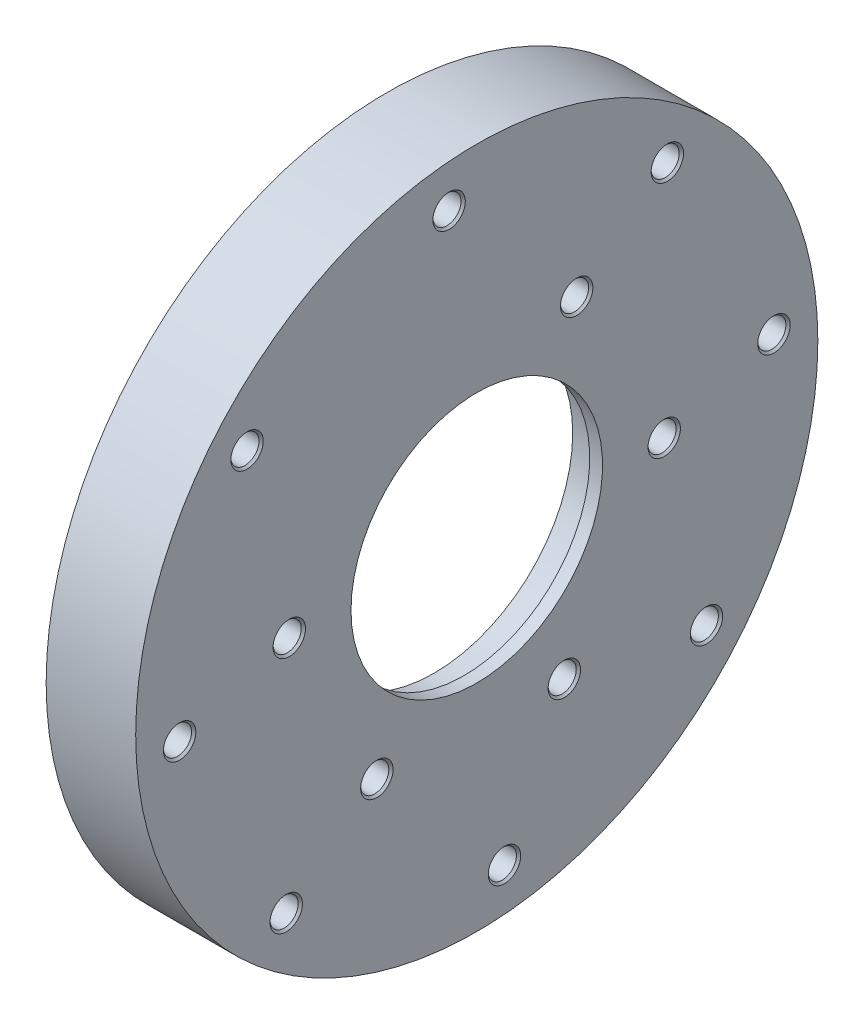
from build123d import *

# Parameters (mm, degrees)
SKETCH3_R          = 2.51
CUT_EXTRUDE1_DEPTH = 4
SKETCH6_R          = 3
CUT_EXTRUDE4_DEPTH = 11
SKETCH7_R          = 3.3
CUT_EXTRUDE5_DEPTH = 10
SKETCH9_R          = 1
CUT_EXTRUDE7_DEPTH = 2
CUT_EXTRUDE8_REACH = 117.07
SKETCH10_R         = 3.3
CHAMFER1_SIZE      = 0.5


with BuildPart() as part:
    # Sketch2 → Revolve1 (revolve)
    with BuildSketch(Plane.XY):
        Polygon((0, 80), (0, 52.5), (11, 52.5), (11, 32.5), (18, 32.5), (18, 29.5), (21, 29.5), (21, 80), align=None)
    revolve(axis=Axis((0, 0, 0), (1, 0, 0)))

    # Sketch3 → Cut-Extrude1 (cut)
    with BuildSketch(Plane.ZY):
        with Locations((0, 60)):
            Circle(SKETCH3_R)
        with Locations((12.077911205, 58.771796475)):
            Circle(SKETCH3_R)
        with Locations((23.661351307, 55.137468697)):
            Circle(SKETCH3_R)
        with Locations((34.276092906, 49.245806472)):
            Circle(SKETCH3_R)
        with Locations((43.487567234, 41.338015145)):
            Circle(SKETCH3_R)
        with Locations((50.91865545, 31.73784062)):
            Circle(SKETCH3_R)
        with Locations((56.265127929, 20.838315171)):
            Circle(SKETCH3_R)
        with Locations((59.30809946, 9.08566665)):
            Circle(SKETCH3_R)
        with Locations((59.92299043, -3.03895013)):
            Circle(SKETCH3_R)
        with Locations((58.084627132, -15.039151936)):
            Circle(SKETCH3_R)
        with Locations((53.868272374, -26.423649093)):
            Circle(SKETCH3_R)
        with Locations((47.446544216, -36.726358953)):
            Circle(SKETCH3_R)
        with Locations((39.082348963, -45.525487362)):
            Circle(SKETCH3_R)
        with Locations((29.118117752, -52.460796969)):
            Circle(SKETCH3_R)
        with Locations((17.961787378, -57.248355384)):
            Circle(SKETCH3_R)
        with Locations((6.070099319, -59.692159404)):
            Circle(SKETCH3_R)
        with Locations((-6.070099319, -59.692159404)):
            Circle(SKETCH3_R)
        with Locations((-17.961787378, -57.248355384)):
            Circle(SKETCH3_R)
        with Locations((-29.118117752, -52.460796969)):
            Circle(SKETCH3_R)
        with Locations((-39.082348963, -45.525487362)):
            Circle(SKETCH3_R)
        with Locations((-47.446544216, -36.726358953)):
            Circle(SKETCH3_R)
        with Locations((-53.868272374, -26.423649093)):
            Circle(SKETCH3_R)
        with Locations((-58.084627132, -15.039151936)):
            Circle(SKETCH3_R)
        with Locations((-59.92299043, -3.03895013)):
            Circle(SKETCH3_R)
        with Locations((-59.30809946, 9.08566665)):
            Circle(SKETCH3_R)
        with Locations((-56.265127929, 20.838315171)):
            Circle(SKETCH3_R)
        with Locations((-50.91865545, 31.73784062)):
            Circle(SKETCH3_R)
        with Locations((-43.487567234, 41.338015145)):
            Circle(SKETCH3_R)
        with Locations((-34.276092906, 49.245806472)):
            Circle(SKETCH3_R)
        with Locations((-23.661351307, 55.137468697)):
            Circle(SKETCH3_R)
        with Locations((-12.077911205, 58.771796475)):
            Circle(SKETCH3_R)
    extrude(amount=-CUT_EXTRUDE1_DEPTH, mode=Mode.SUBTRACT)

    # Sketch6 → Cut-Extrude4 (cut)
    with BuildSketch(Plane.ZY):
        with Locations((53.875586653, 44.692517973)):
            Circle(SKETCH6_R)
        with Locations((69.69817519, -6.493410136)):
            Circle(SKETCH6_R)
        with Locations((44.692517973, -53.875586653)):
            Circle(SKETCH6_R)
        with Locations((-6.493410136, -69.69817519)):
            Circle(SKETCH6_R)
        with Locations((-53.875586653, -44.692517973)):
            Circle(SKETCH6_R)
        with Locations((-69.69817519, 6.493410136)):
            Circle(SKETCH6_R)
        with Locations((-44.692517973, 53.875586653)):
            Circle(SKETCH6_R)
        with Locations((6.493410136, 69.69817519)):
            Circle(SKETCH6_R)
    extrude(amount=-CUT_EXTRUDE4_DEPTH, mode=Mode.SUBTRACT)

    # Sketch7 → Cut-Extrude5 (cut)
    with BuildSketch(Plane.ZY.offset(-21)):
        with Locations((53.875586653, 44.692517973)):
            Circle(SKETCH7_R)
        with Locations((69.69817519, -6.493410136)):
            Circle(SKETCH7_R)
        with Locations((44.692517973, -53.875586653)):
            Circle(SKETCH7_R)
        with Locations((-6.493410136, -69.69817519)):
            Circle(SKETCH7_R)
        with Locations((-53.875586653, -44.692517973)):
            Circle(SKETCH7_R)
        with Locations((-69.69817519, 6.493410136)):
            Circle(SKETCH7_R)
        with Locations((-44.692517973, 53.875586653)):
            Circle(SKETCH7_R)
        with Locations((6.493410136, 69.69817519)):
            Circle(SKETCH7_R)
    extrude(amount=CUT_EXTRUDE5_DEPTH, mode=Mode.SUBTRACT)

    # Sketch9 → Cut-Extrude7 (cut)
    with BuildSketch(Plane.ZY):
        with Locations((2.51770285, -71.46627686)):
            Circle(SKETCH9_R)
    extrude(amount=-CUT_EXTRUDE7_DEPTH, mode=Mode.SUBTRACT)

    # Sketch10 → Cut-Extrude8 (cut, up to next)
    with BuildSketch(Plane(origin=(21, 0, 0), x_dir=(0, 0, -1), z_dir=(1, 0, 0)), mode=Mode.PRIVATE) as cut_extrude8_sk1:
        with Locations((23.431880753, 37.241736861)):
            Circle(SKETCH10_R)
    cut_extrude8_tool1 = extrude(cut_extrude8_sk1.sketch, amount=-CUT_EXTRUDE8_REACH, mode=Mode.PRIVATE) & part.part
    # Sketch10 → Cut-Extrude8 (cut, up to next)
    with BuildSketch(Plane(origin=(21, 0, 0), x_dir=(0, 0, -1), z_dir=(1, 0, 0)), mode=Mode.PRIVATE) as cut_extrude8_sk2:
        with Locations((20.536349826, -38.913472421)):
            Circle(SKETCH10_R)
    cut_extrude8_tool2 = extrude(cut_extrude8_sk2.sketch, amount=-CUT_EXTRUDE8_REACH, mode=Mode.PRIVATE) & part.part
    # Sketch10 → Cut-Extrude8 (cut, up to next)
    with BuildSketch(Plane(origin=(21, 0, 0), x_dir=(0, 0, -1), z_dir=(1, 0, 0)), mode=Mode.PRIVATE) as cut_extrude8_sk3:
        with Locations((-43.968230579, 1.67173556)):
            Circle(SKETCH10_R)
    cut_extrude8_tool3 = extrude(cut_extrude8_sk3.sketch, amount=-CUT_EXTRUDE8_REACH, mode=Mode.PRIVATE) & part.part
    # Sketch10 → Cut-Extrude8 (cut, up to next)
    with BuildSketch(Plane(origin=(21, 0, 0), x_dir=(0, 0, -1), z_dir=(1, 0, 0)), mode=Mode.PRIVATE) as cut_extrude8_sk4:
        with Locations((-23.431880753, -37.241736861)):
            Circle(SKETCH10_R)
    cut_extrude8_tool4 = extrude(cut_extrude8_sk4.sketch, amount=-CUT_EXTRUDE8_REACH, mode=Mode.PRIVATE) & part.part
    # Sketch10 → Cut-Extrude8 (cut, up to next)
    with BuildSketch(Plane(origin=(21, 0, 0), x_dir=(0, 0, -1), z_dir=(1, 0, 0)), mode=Mode.PRIVATE) as cut_extrude8_sk5:
        with Locations((43.968230579, -1.67173556)):
            Circle(SKETCH10_R)
    cut_extrude8_tool5 = extrude(cut_extrude8_sk5.sketch, amount=-CUT_EXTRUDE8_REACH, mode=Mode.PRIVATE) & part.part
    add(cut_extrude8_tool1.solids().sort_by_distance((21, 37.241737, -23.431881))[0], mode=Mode.SUBTRACT)
    add(cut_extrude8_tool2.solids().sort_by_distance((21, -38.913472, -20.53635))[0], mode=Mode.SUBTRACT)
    add(cut_extrude8_tool3.solids().sort_by_distance((21, 1.671736, 43.968231))[0], mode=Mode.SUBTRACT)
    add(cut_extrude8_tool4.solids().sort_by_distance((21, -37.241737, 23.431881))[0], mode=Mode.SUBTRACT)
    add(cut_extrude8_tool5.solids().sort_by_distance((21, -1.671736, -43.968231))[0], mode=Mode.SUBTRACT)

    # Chamfer1
    chamfer1_edges = [part.edges().sort_by_distance(p)[0] for p in [
        (21, -53.875586653, 41.392517973),
        (21, -69.69817519, -9.793410136),
        (21, -44.692517973, -57.175586653),
        (21, 6.493410136, -72.99817519),
        (21, 44.692517973, 50.575586653),
        (21, -6.493410136, 66.39817519),
        (21, 1.67173556, 47.268230579),
        (21, -38.913472421, -17.236349826),
        (21, 37.241736861, -20.131880753),
        (21, -37.241736861, 26.731880753),
        (21, -1.67173556, -40.668230579),
        (21, 69.69817519, 3.193410136),
        (21, 53.875586653, -47.992517973),
    ]]
    chamfer(chamfer1_edges, length=CHAMFER1_SIZE)


solid = part.part
